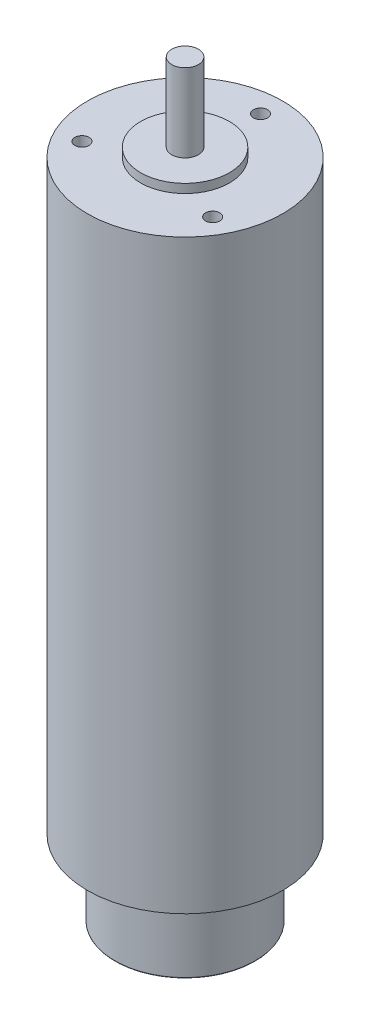
from build123d import *

# Parameters (mm, degrees)
SKETCH_1_R               = 11
EXTRUDE_1_DEPTH          = 66
SKETCH_2_R               = 5
EXTRUDE_2_DEPTH          = 1
SKETCH_3_R               = 1.5
EXTRUDE_3_DEPTH          = 8.8
SKETCH_4_R               = 7.9
EXTRUDE_4_DEPTH          = 8.5
FILLET_2_R               = 0.1
PATTERN_CIRCULAR_2_COUNT = 3


with BuildPart() as part:
    # Sketch 1 → 보스-돌출1 (new body)
    with BuildSketch(Plane(origin=(0, 0, 0), x_dir=(1, 0, 0), z_dir=(0, 1, 0))):
        Circle(SKETCH_1_R)
    extrude(amount=EXTRUDE_1_DEPTH)

    # 스케치8 → M2 나사 구멍1 (revolve, cut)
    with BuildSketch(Plane(origin=(0, 66, -8.5), x_dir=(0, 0, 1), z_dir=(1, 0, 0))):
        Polygon((0, 0), (0, 5.480688495), (0.8, 5), (0.8, 0), align=None)
    hole_wizard_m2_1 = revolve(axis=Axis((0, 72.35, -8.5), (0, -1, 0)), mode=Mode.SUBTRACT)

    # 원형 패턴2: M2 나사 구멍1 ×3 about axis
    pattern_circular_2_axis = Axis((0, 66, 0), (0, 1, 0))
    for i in range(1, PATTERN_CIRCULAR_2_COUNT):
        add(hole_wizard_m2_1.rotate(pattern_circular_2_axis, i * 360 / PATTERN_CIRCULAR_2_COUNT), mode=Mode.SUBTRACT)


with BuildPart() as body_2:
    # 스케치2 → 보스-돌출2 (new body)
    with BuildSketch(Plane(origin=(0, 66, 0), x_dir=(1, 0, 0), z_dir=(0, 1, 0))):
        Circle(SKETCH_2_R)
    extrude(amount=EXTRUDE_2_DEPTH)


with BuildPart() as body_3:
    # 스케치3 → 보스-돌출3 (new body)
    with BuildSketch(Plane(origin=(0, 67, 0), x_dir=(1, 0, 0), z_dir=(0, 1, 0))):
        Circle(SKETCH_3_R)
    extrude(amount=EXTRUDE_3_DEPTH)


with BuildPart() as body_4:
    # 스케치4 → 보스-돌출4 (new body)
    with BuildSketch(Plane.XZ):
        Circle(SKETCH_4_R)
    extrude(amount=EXTRUDE_4_DEPTH)

    # 필렛2
    fillet_2_edges = [body_4.edges().sort_by_distance(p)[0] for p in [
        (-7.9, -8.5, 0),
    ]]
    fillet(fillet_2_edges, radius=FILLET_2_R)


solid = Compound([part.part, body_2.part, body_3.part, body_4.part])
